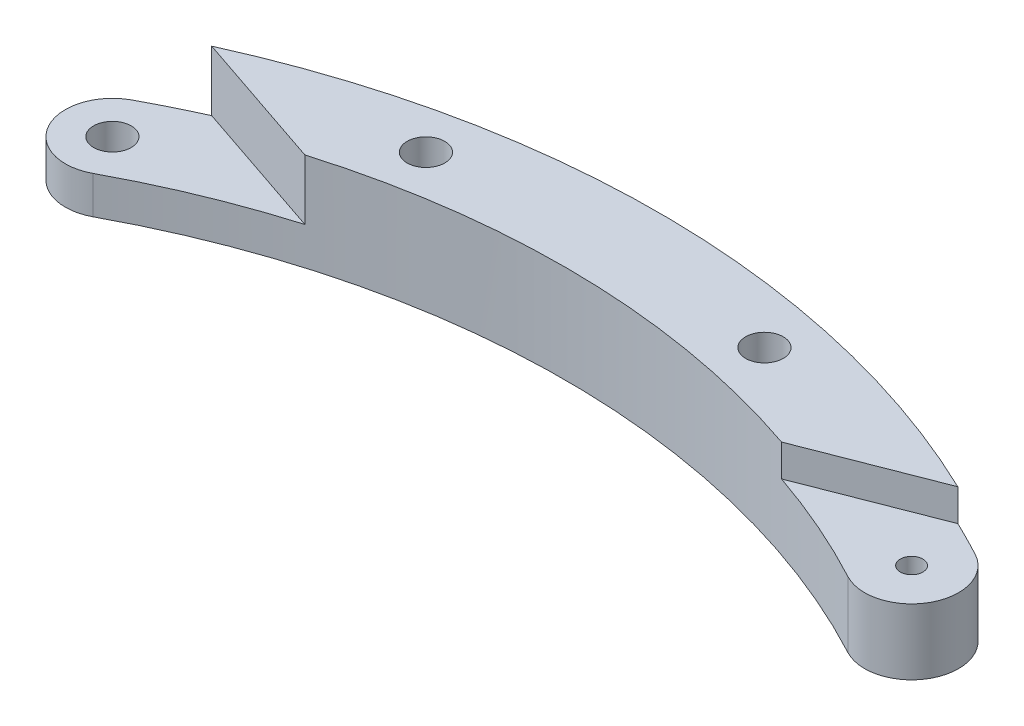
from build123d import *

# Parameters (mm, degrees)
SKETCH2_R           = 1
SKETCH2_R_2         = 0.6
BOSS_EXTRUDE2_DEPTH = 2
BOSS_EXTRUDE3_DEPTH = 3.2
SKETCH4_R           = 0.6
BOSS_EXTRUDE4_DEPTH = 1.5
SKETCH5_R           = 1
CUT_EXTRUDE1_DEPTH  = 46.971757444


with BuildPart() as part:
    # Sketch2 → Boss-Extrude2 (new body)
    with BuildSketch(Plane(origin=(0, 0, 0), x_dir=(1, 0, 0), z_dir=(0, 1, 0))):
        with BuildLine():
            ThreePointArc((43.680555556, 2.203698841), (21.25, 7.833420868), (-1.180555556, 2.203698841))
            ThreePointArc((-1.180555556, 2.203698841), (-2.203698841, -1.180555556), (1.180555556, -2.203698841))
            ThreePointArc((1.180555556, -2.203698841), (21.25, 2.833420868), (41.319444444, -2.203698841))
            ThreePointArc((41.319444444, -2.203698841), (44.703698841, -1.180555556), (43.680555556, 2.203698841))
        make_face()
        Circle(SKETCH2_R, mode=Mode.SUBTRACT)
        with Locations((42.5, 0)):
            Circle(SKETCH2_R_2, mode=Mode.SUBTRACT)
    extrude(amount=BOSS_EXTRUDE2_DEPTH)

    # Sketch3 → Boss-Extrude3 (add)
    with BuildSketch(Plane(origin=(0, 2, 0), x_dir=(1, 0, 0), z_dir=(0, 1, 0))):
        with BuildLine():
            ThreePointArc((41.798567685, 3.158721406), (21.784485497, 7.830413671), (1.670343314, 3.610285866))
            Line((1.670343314, 3.610285866), (9.157651663, 1.076826613))
            ThreePointArc((9.157651663, 1.076826613), (22.148316133, 2.823926021), (35.053533161, 0.529346934))
            Line((35.053533161, 0.529346934), (41.798567685, 3.158721406))
        make_face()
    extrude(amount=BOSS_EXTRUDE3_DEPTH)

    # Sketch4 → Boss-Extrude4 (add)
    with BuildSketch(Plane(origin=(0, 2, 0), x_dir=(1, 0, 0), z_dir=(0, 1, 0))):
        with BuildLine():
            ThreePointArc((43.680555556, 2.203698841), (42.744866263, 2.691663565), (41.798567685, 3.158721406))
            Line((41.798567685, 3.158721406), (35.053533161, 0.529346934))
            ThreePointArc((35.053533161, 0.529346934), (38.241528412, -0.710989517), (41.319444444, -2.203698841))
            ThreePointArc((41.319444444, -2.203698841), (44.703698841, -1.180555556), (43.680555556, 2.203698841))
        make_face()
        with Locations((42.5, 0)):
            Circle(SKETCH4_R, mode=Mode.SUBTRACT)
    extrude(amount=BOSS_EXTRUDE4_DEPTH)

    # Sketch5 → Cut-Extrude1 (cut, through all)
    with BuildSketch(Plane(origin=(0, 5.2, 0), x_dir=(1, 0, 0), z_dir=(0, 1, 0))):
        with Locations((12.25, 4.424236239)):
            Circle(SKETCH5_R)
        with Locations((30.25, 4.424236239)):
            Circle(SKETCH5_R)
    extrude(amount=-CUT_EXTRUDE1_DEPTH, mode=Mode.SUBTRACT)


solid = part.part
